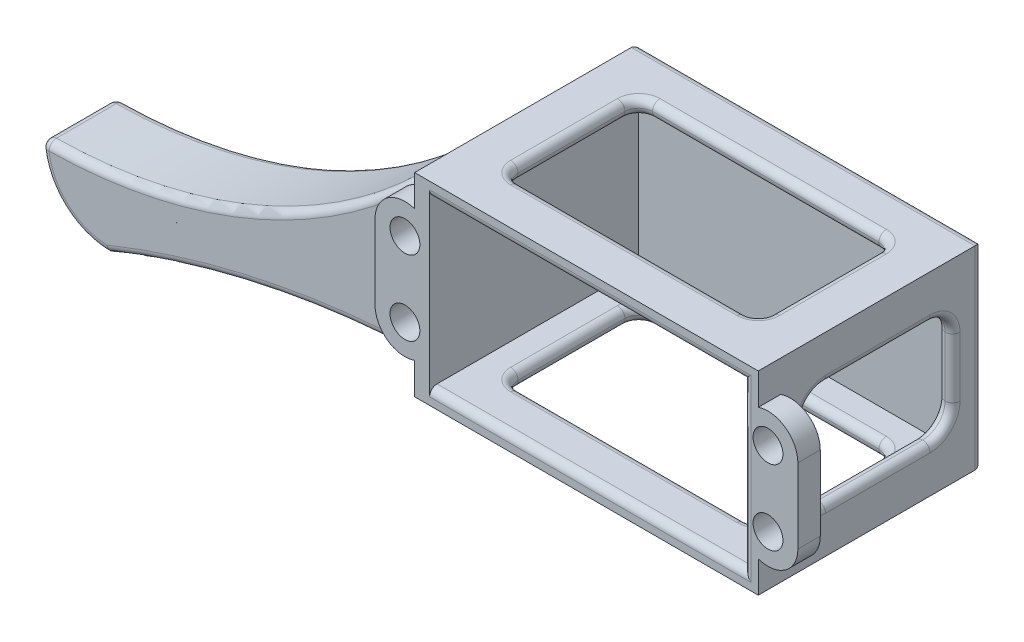
from build123d import *

# Parameters (mm, degrees)
SKETCH1_W               = 46
SKETCH1_H               = 26
BOSS_EXTRUDE3_DEPTH     = 30
SHELL1_T                = -2
CUT_EXTRUDE2_START      = 25
SKETCH4_R               = 2
CUT_EXTRUDE2_DEPTH      = 17
BOSS_EXTRUDE4_START     = -3
BOSS_EXTRUDE4_DEPTH     = 3
BOSS_EXTRUDE16_DEPTH    = 5
BOSS_EXTRUDE18_START    = -15
BOSS_EXTRUDE18_DEPTH    = 10
CUT_EXTRUDE5_DEPTH      = 91.603532065
CUT_EXTRUDE5_DEPTH_BACK = 91.603532065
FILLET50_R              = 1
CUT_EXTRUDE6_DEPTH      = 10
FILLET51_R              = 1


with BuildPart() as part:
    # Sketch1 → Boss-Extrude3 (new body)
    with BuildSketch(Plane.XY):
        Rectangle(SKETCH1_W, SKETCH1_H)
    extrude(amount=BOSS_EXTRUDE3_DEPTH)

    # Shell1
    shell1_openings = [part.faces().sort_by_distance(p)[0] for p in [
        (0, 0, 30),
    ]]
    offset(amount=SHELL1_T, openings=shell1_openings, kind=Kind.INTERSECTION)

    # Sketch4 → Cut-Extrude2 (cut)
    with BuildSketch(Plane.XY.offset(CUT_EXTRUDE2_START)):
        with Locations((24.3, 5)):
            Circle(SKETCH4_R)
        with Locations((24.3, -5)):
            Circle(SKETCH4_R)
        with Locations((-24.3, 5)):
            Circle(SKETCH4_R)
        with Locations((-24.3, -5)):
            Circle(SKETCH4_R)
    extrude(amount=CUT_EXTRUDE2_DEPTH, mode=Mode.SUBTRACT)

    # Sketch2 → Boss-Extrude4 (add)
    with BuildSketch(Plane.XY.offset(30).offset(BOSS_EXTRUDE4_START)):
        with BuildLine():
            ThreePointArc((-23, 8.782856064), (-26.623790008, 8.255764119), (-28.3, 5))
            Line((-28.3, 5), (-28.3, -5))
            ThreePointArc((-28.3, -5), (-26.623790008, -8.255764119), (-23, -8.782856064))
            Line((-23, -8.782856064), (-23, -6.519868415))
            ThreePointArc((-23, -6.519868415), (-26.3, -5), (-23, -3.480131585))
            Line((-23, -3.480131585), (-23, 3.480131585))
            ThreePointArc((-23, 3.480131585), (-26.3, 5), (-23, 6.519868415))
            Line((-23, 6.519868415), (-23, 8.782856064))
        make_face()
        with BuildLine():
            ThreePointArc((28.3, 5), (26.623790008, 8.255764119), (23, 8.782856064))
            Line((23, 8.782856064), (23, 6.519868415))
            ThreePointArc((23, 6.519868415), (26.3, 5), (23, 3.480131585))
            Line((23, 3.480131585), (23, -3.480131585))
            ThreePointArc((23, -3.480131585), (26.3, -5), (23, -6.519868415))
            Line((23, -6.519868415), (23, -8.782856064))
            ThreePointArc((23, -8.782856064), (26.623790008, -8.255764119), (28.3, -5))
            Line((28.3, -5), (28.3, 5))
        make_face()
    extrude(amount=BOSS_EXTRUDE4_DEPTH)

    # Sketch9 → Boss-Extrude16 (add)
    with BuildSketch(Plane.XY):
        with BuildLine():
            ThreePointArc((15, 0), (13.681980515, 3.181980515), (10.5, 4.5))
            Line((10.5, 4.5), (10.5, -4.5))
            ThreePointArc((10.5, -4.5), (13.681980515, -3.181980515), (15, 0))
        make_face()
        with BuildLine():
            Line((10.5, -4.5), (10.5, 4.5))
            ThreePointArc((10.5, 4.5), (6, 0), (10.5, -4.5))
        make_face()
    extrude(amount=-BOSS_EXTRUDE16_DEPTH)

    # Sketch14 → Boss-Extrude18 (add)
    with BuildSketch(Plane(origin=(0, 0, 0), x_dir=(-1, 0, 0), z_dir=(0, 0, -1)).offset(BOSS_EXTRUDE18_START)):
        with BuildLine():
            Line((23, 13), (23, -13))
            ThreePointArc((23, -13), (46.436083291, -15.271129848), (69, -22))
            ThreePointArc((69, -22), (75.363961031, -19.363961031), (78, -13))
            ThreePointArc((78, -13), (47.582077651, -6.172528045), (23, 13))
        make_face()
        with BuildLine():
            add(Edge.make_bspline(
                [(59.906165351, -13.759241877), (59.781268702, -13.717320791), (59.659348974, -13.685795892), (59.543496906, -13.667043022)],
                knots=[0.928317086, 0.928317086, 0.928317086, 0.928317086, 1, 1, 1, 1], degree=3))
            ThreePointArc((59.906165351, -13.759241877), (59.724772985, -13.713371159), (59.543496906, -13.667043022))
        make_face(mode=Mode.SUBTRACT)
    extrude(amount=-BOSS_EXTRUDE18_DEPTH)

    # Sketch6 → Cut-Extrude5 (cut, two sides: drawn at the far end of the back side and taken through both)
    with BuildSketch(Plane(origin=(0, 13, 0), x_dir=(1, 0, 0), z_dir=(0, 1, 0)).offset(-CUT_EXTRUDE5_DEPTH_BACK)):
        with BuildLine():
            Line((15.151778421, -6), (-15.151778421, -6))
            ThreePointArc((-15.151778421, -6), (-16.458668433, -6.541331567), (-17, -7.848221579))
            Line((-17, -7.848221579), (-17, -22.151778421))
            ThreePointArc((-17, -22.151778421), (-16.458668433, -23.458668433), (-15.151778421, -24))
            Line((-15.151778421, -24), (15.151778421, -24))
            ThreePointArc((15.151778421, -24), (16.458668433, -23.458668433), (17, -22.151778421))
            Line((17, -22.151778421), (17, -7.848221579))
            ThreePointArc((17, -7.848221579), (16.458668433, -6.541331567), (15.151778421, -6))
        make_face()
    extrude(amount=CUT_EXTRUDE5_DEPTH + CUT_EXTRUDE5_DEPTH_BACK, mode=Mode.SUBTRACT)

    # Fillet50
    fillet50_edges = [part.edges().sort_by_distance(p)[0] for p in [
        (16.458668433, 13, 6.541331567),
        (17, 13, 15),
        (16.458668433, 13, 23.458668433),
        (0, 13, 24),
        (-16.458668433, 13, 23.458668433),
        (-17, 13, 15),
        (-16.458668433, 13, 6.541331567),
        (-16.458668433, 11, 6.541331567),
        (-17, 11, 15),
        (-16.458668433, 11, 23.458668433),
        (0, 11, 24),
        (16.458668433, 11, 23.458668433),
        (17, 11, 15),
        (16.458668433, 11, 6.541331567),
        (16.458668433, -13, 6.541331567),
        (17, -13, 15),
        (16.458668433, -13, 23.458668433),
        (0, -13, 24),
        (-16.458668433, -13, 23.458668433),
        (-17, -13, 15),
        (-16.458668433, -13, 6.541331567),
        (16.458668433, -11, 6.541331567),
        (17, -11, 15),
        (16.458668433, -11, 23.458668433),
        (0, -11, 24),
        (-16.458668433, -11, 23.458668433),
        (-17, -11, 15),
        (-16.458668433, -11, 6.541331567),
        (-23, 0, 0),
        (0, -13, 0),
        (23, 0, 0),
        (0, 13, 0),
        (0, 13, 6),
        (0, 11, 6),
        (0, -13, 6),
        (0, -11, 6),
        (-75.363961031, -19.363961031, 15),
        (-75.363961031, -19.363961031, 25),
        (-46.436083291, -15.271129848, 15),
        (-46.436083291, -15.271129848, 25),
        (-78, -13, 20),
        (-47.582077651, -6.172528045, 15),
        (-47.582077651, -6.172528045, 25),
        (0, -11, 30),
        (0, 11, 30),
        (21, 0, 30),
    ]]
    fillet(fillet50_edges, radius=FILLET50_R - 0.0001)  # a hair under: the kernel refuses the full size

    # Sketch17 → Cut-Extrude6 (cut)
    with BuildSketch(Plane(origin=(23, 0, 0), x_dir=(0, 0, -1), z_dir=(1, 0, 0))):
        with BuildLine():
            Line((-24, 4), (-24, -4))
            ThreePointArc((-24, -4), (-23.121320344, -6.121320344), (-21, -7))
            Line((-21, -7), (-10, -7))
            ThreePointArc((-10, -7), (-7.878679656, -6.121320344), (-7, -4))
            Line((-7, -4), (-7, 4))
            ThreePointArc((-7, 4), (-7.878679656, 6.121320344), (-10, 7))
            Line((-10, 7), (-21, 7))
            ThreePointArc((-21, 7), (-23.121320344, 6.121320344), (-24, 4))
        make_face()
        with BuildLine():
            Line((-21, 4), (-21, -4))
            ThreePointArc((-21, -4), (-20.121320344, -6.121320344), (-18, -7))
            Line((-18, -7), (-7, -7))
            ThreePointArc((-7, -7), (-4.878679656, -6.121320344), (-4, -4))
            Line((-4, -4), (-4, 4))
            ThreePointArc((-4, 4), (-4.878679656, 6.121320344), (-7, 7))
            Line((-7, 7), (-18, 7))
            ThreePointArc((-18, 7), (-20.121320344, 6.121320344), (-21, 4))
        make_face()
    extrude(amount=-CUT_EXTRUDE6_DEPTH, mode=Mode.SUBTRACT)

    # Fillet51
    fillet51_edges = [part.edges().sort_by_distance(p)[0] for p in [
        (21, -6.121320344, 4.878679656),
        (21, -7, 14),
        (21, -6.121320344, 23.121320344),
        (21, 0, 24),
        (21, 6.121320344, 23.121320344),
        (21, 7, 14),
        (21, 6.121320344, 4.878679656),
        (23, 6.121320344, 4.878679656),
        (23, 7, 14),
        (23, 6.121320344, 23.121320344),
        (23, 0, 24),
        (23, -6.121320344, 23.121320344),
        (23, -7, 14),
        (23, -6.121320344, 4.878679656),
        (21, 0, 4),
        (23, 0, 4),
    ]]
    fillet(fillet51_edges, radius=FILLET51_R - 0.0001)  # a hair under: the kernel refuses the full size


solid = part.part
